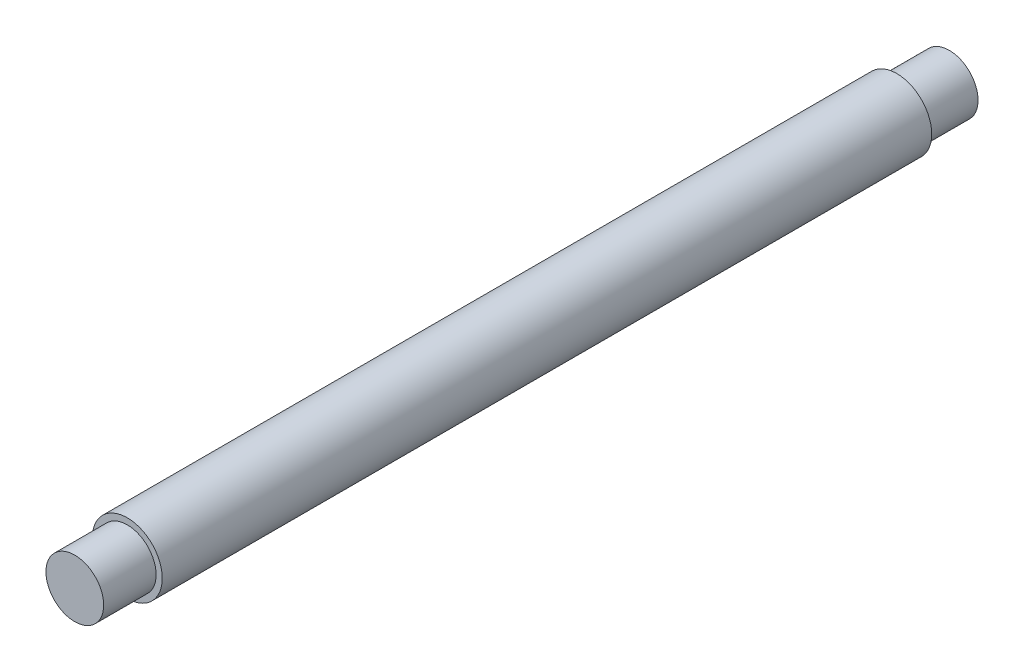
from build123d import *

# Parameters (mm, degrees)
BOSS_EXTRUDE1_DEPTH      = 220
BOSS_EXTRUDE1_DEPTH_BACK = 220
SKETCH2_R                = 20
SKETCH3_R                = 16.5
BOSS_EXTRUDE2_DEPTH      = 30
BOSS_EXTRUDE3_START      = 30
SKETCH4_R                = 16.5
BOSS_EXTRUDE3_DEPTH      = 30
SKETCH5_W                = 430
SKETCH5_H                = 15


with BuildPart() as part:
    # Sketch2 → Boss-Extrude1 (new, two sides: drawn at the far end of the back side and taken through both)
    with BuildSketch(Plane.XY.offset(-BOSS_EXTRUDE1_DEPTH_BACK)):
        Circle(SKETCH2_R)
    extrude(amount=BOSS_EXTRUDE1_DEPTH + BOSS_EXTRUDE1_DEPTH_BACK)

    # Sketch3 → Boss-Extrude2 (add)
    with BuildSketch(Plane.XY.offset(220)):
        Circle(SKETCH3_R)
    extrude(amount=BOSS_EXTRUDE2_DEPTH)

    # Sketch4 → Boss-Extrude3 (add)
    with BuildSketch(Plane(origin=(0, 0, -220), x_dir=(-1, 0, 0), z_dir=(0, 0, -1)).offset(BOSS_EXTRUDE3_START)):
        Circle(SKETCH4_R)
    extrude(amount=-BOSS_EXTRUDE3_DEPTH)

    # Sketch5 → Cut-Revolve1 (revolve, cut)
    with BuildSketch(Plane(origin=(0, 0, 0), x_dir=(0, 0, -1), z_dir=(1, 0, 0))):
        with Locations((0, 7.5)):
            Rectangle(SKETCH5_W, SKETCH5_H)
    revolve(axis=Axis((0, 0, 215), (0, 0, -1)), mode=Mode.SUBTRACT)


solid = part.part
